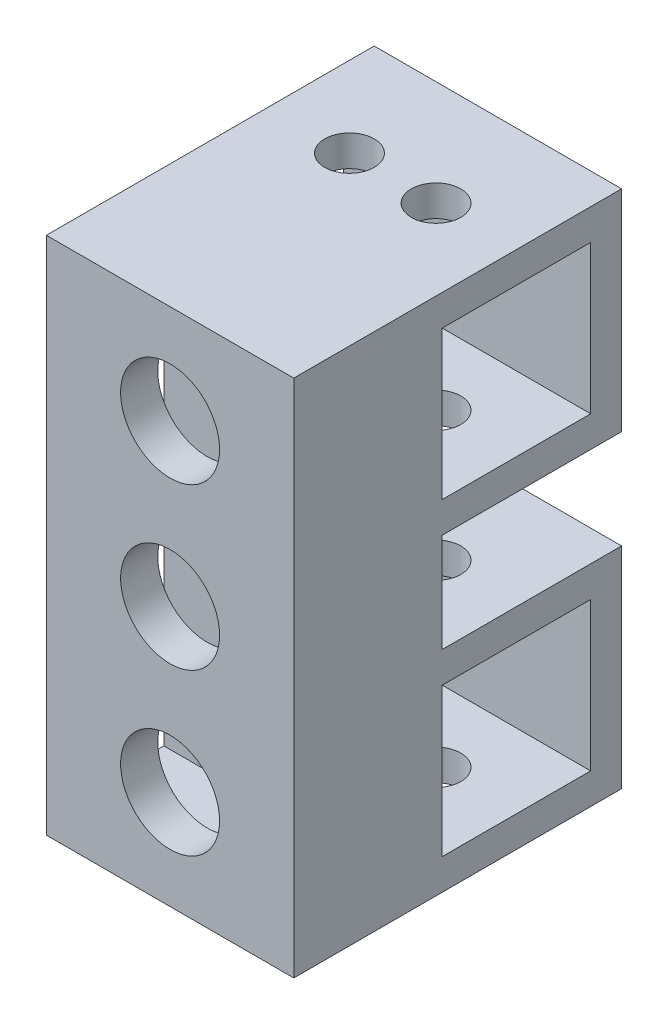
from build123d import *

# Parameters (mm, degrees)
BOSS_EXTRU_1_DEPTH      = 12
ESQUISSE2_W             = 20
ESQUISSE2_H             = 17
BOSS_EXTRU_3_DEPTH      = 14.5
ESQUISSE3_W             = 12
ESQUISSE3_H             = 12
ENL_V_MAT_EXTRU_3_DEPTH = 49.726276279
ESQUISSE4_R             = 2
ENL_V_MAT_EXTRU_4_DEPTH = 42
ENL_V_START             = -3
ENL_V_MAT_EXTRU_5_DEPTH = 6.5
ESQUISSE6_R             = 4
ENL_V_MAT_EXTRU_6_DEPTH = 13.5


with BuildPart() as part:
    # Esquisse1 → Boss.-Extru.1 (new body)
    with BuildSketch(Plane.XY):
        Polygon((0, -41.5), (0, -42), (20, -42), (20, -41.5), (20, -18.5), (20, -10.5), (20, 0), (0, 0), (0, -10.5), (0, -18.5), align=None)
    extrude(amount=BOSS_EXTRU_1_DEPTH)

    # Esquisse2 → Boss.-Extru.3 (add)
    with BuildSketch(Plane(origin=(0, 0, 0), x_dir=(-1, 0, 0), z_dir=(0, 0, -1))):
        with Locations((-10, -33.5)):
            Rectangle(ESQUISSE2_W, ESQUISSE2_H)
    boss_extru_3 = extrude(amount=BOSS_EXTRU_3_DEPTH)

    # Esquisse3 → Enlèv. mat.-Extru.3 (cut, through all)
    with BuildSketch(Plane(origin=(20, 0, 0), x_dir=(0, 0, -1), z_dir=(1, 0, 0))):
        with Locations((6, -33.5)):
            Rectangle(ESQUISSE3_W, ESQUISSE3_H)
    enl_v_mat_extru_3 = extrude(amount=-ENL_V_MAT_EXTRU_3_DEPTH, mode=Mode.SUBTRACT)

    # Symétrie1: Boss.-Extru.3, Enlèv. mat.-Extru.3 across plane
    add(boss_extru_3.mirror(Plane(origin=(0, -21, 0), x_dir=(0, 0, 1), z_dir=(0, -1, 0))))
    add(enl_v_mat_extru_3.mirror(Plane(origin=(0, -21, 0), x_dir=(0, 0, 1), z_dir=(0, -1, 0))), mode=Mode.SUBTRACT)

    # Esquisse4 → Enlèv. mat.-Extru.4 (cut)
    with BuildSketch(Plane.XZ.offset(42)):
        with Locations((13.5, -6)):
            Circle(ESQUISSE4_R)
        with Locations((6.5, -6)):
            Circle(ESQUISSE4_R)
    extrude(amount=-ENL_V_MAT_EXTRU_4_DEPTH, mode=Mode.SUBTRACT)

    # Esquisse5 → Enlèv. mat.-Extru.5 (cut)
    with BuildSketch(Plane.XY.offset(12).offset(ENL_V_START)):
        Polygon((17.505553499, -34), (13.75277675, -27.5), (17.505553499, -21), (13.75277675, -14.5), (17.505553499, -8), (13.75277675, -1.5), (0, -1.5), (0, -40.5), (13.75277675, -40.5), align=None)
    extrude(amount=-ENL_V_MAT_EXTRU_5_DEPTH, mode=Mode.SUBTRACT)

    # Esquisse6 → Enlèv. mat.-Extru.6 (cut)
    with BuildSketch(Plane.XY.offset(12)):
        with Locations((10, -34)):
            Circle(ESQUISSE6_R)
        with Locations((10, -21)):
            Circle(ESQUISSE6_R)
        with Locations((10, -8)):
            Circle(ESQUISSE6_R)
    extrude(amount=-ENL_V_MAT_EXTRU_6_DEPTH, mode=Mode.SUBTRACT)


solid = part.part
